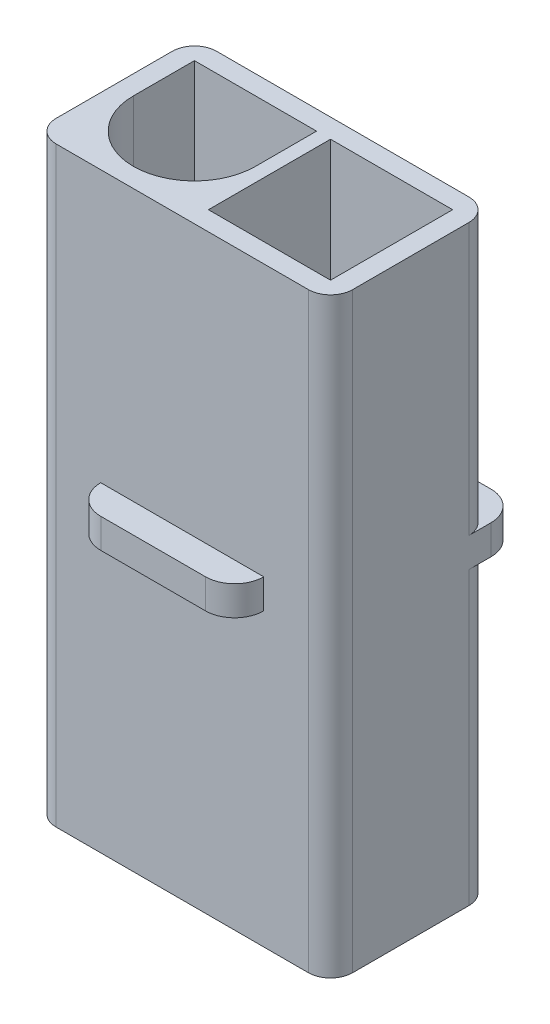
from build123d import *

# Parameters (mm, degrees)
SKETCH1_W           = 13.36
SKETCH1_H           = 7.23
BOSS_EXTRUDE1_DEPTH = 13.325
SKETCH2_W           = 5.5
SKETCH2_H           = 5.5
CUT_EXTRUDE1_DEPTH  = 10
CUT_EXTRUDE2_START  = -11.75
SKETCH3_R           = 2.75
CUT_EXTRUDE2_DEPTH  = 11.75
BOSS_EXTRUDE2_DEPTH = 1.8
BOSS_EXTRUDE3_DEPTH = 1.33
FILLET1_R           = 1


with BuildPart() as part:
    # Sketch1 → Boss-Extrude1 (new, symmetric)
    with BuildSketch(Plane(origin=(0, 0, 0), x_dir=(1, 0, 0), z_dir=(0, 1, 0))):
        Rectangle(SKETCH1_W, SKETCH1_H)
    extrude(amount=BOSS_EXTRUDE1_DEPTH, both=True)

    # Sketch2 → Cut-Extrude1 (cut)
    with BuildSketch(Plane(origin=(0, 13.325, 0), x_dir=(1, 0, 0), z_dir=(0, 1, 0))):
        with BuildLine():
            Line((-5.815, 2.75), (-0.315, 2.75))
            Line((-0.315, 2.75), (-0.315, 0))
            ThreePointArc((-0.315, 0), (-3.065, -2.75), (-5.815, 0))
            Line((-5.815, 0), (-5.815, 2.75))
        make_face()
        with Locations((3.065, 0)):
            Rectangle(SKETCH2_W, SKETCH2_H)
    extrude(amount=-CUT_EXTRUDE1_DEPTH, mode=Mode.SUBTRACT)

    # Sketch3 → Cut-Extrude2 (cut)
    with BuildSketch(Plane.XZ.offset(13.325).offset(CUT_EXTRUDE2_START)):
        with Locations((-3.065, 0)):
            Circle(SKETCH3_R)
        with Locations((3.065, 0)):
            Circle(SKETCH3_R)
    extrude(amount=CUT_EXTRUDE2_DEPTH, mode=Mode.SUBTRACT)

    # Sketch4 → Boss-Extrude2 (add, symmetric)
    with BuildSketch(Plane(origin=(0, 0, 0), x_dir=(0, 0, -1), z_dir=(1, 0, 0))):
        Polygon((3.615, 13.325), (5.145, 10.975), (3.615, 10.975), align=None)
    extrude(amount=BOSS_EXTRUDE2_DEPTH, both=True)

    # Sketch5 → Boss-Extrude3 (add)
    with BuildSketch(Plane(origin=(0, -0.215, 0), x_dir=(1, 0, 0), z_dir=(0, 1, 0))):
        with BuildLine():
            Line((-5.37, 4.925), (-4.56, 4.925))
            ThreePointArc((-4.56, 4.925), (-3.633690117, 4.541309883), (-3.25, 3.615))
            Line((-3.25, 3.615), (-6.68, 3.615))
            ThreePointArc((-6.68, 3.615), (-6.296309883, 4.541309883), (-5.37, 4.925))
        make_face()
        with BuildLine():
            Line((4.56, 4.925), (5.37, 4.925))
            ThreePointArc((5.37, 4.925), (6.296309883, 4.541309883), (6.68, 3.615))
            Line((6.68, 3.615), (3.25, 3.615))
            ThreePointArc((3.25, 3.615), (3.633690117, 4.541309883), (4.56, 4.925))
        make_face()
        with BuildLine():
            Line((-2.36, -4.925), (2.36, -4.925))
            ThreePointArc((2.36, -4.925), (3.286309883, -4.541309883), (3.67, -3.615))
            Line((3.67, -3.615), (-3.67, -3.615))
            ThreePointArc((-3.67, -3.615), (-3.286309883, -4.541309883), (-2.36, -4.925))
        make_face()
    extrude(amount=BOSS_EXTRUDE3_DEPTH)

    # Fillet1
    fillet1_edges = [part.edges().sort_by_distance(p)[0] for p in [
        (6.68, 7.22, -3.615),
        (-6.68, 7.22, -3.615),
        (6.68, 0, 3.615),
        (-6.68, 0, 3.615),
        (6.68, -6.77, -3.615),
        (-6.68, -6.77, -3.615),
    ]]
    fillet(fillet1_edges, radius=FILLET1_R)


solid = part.part
